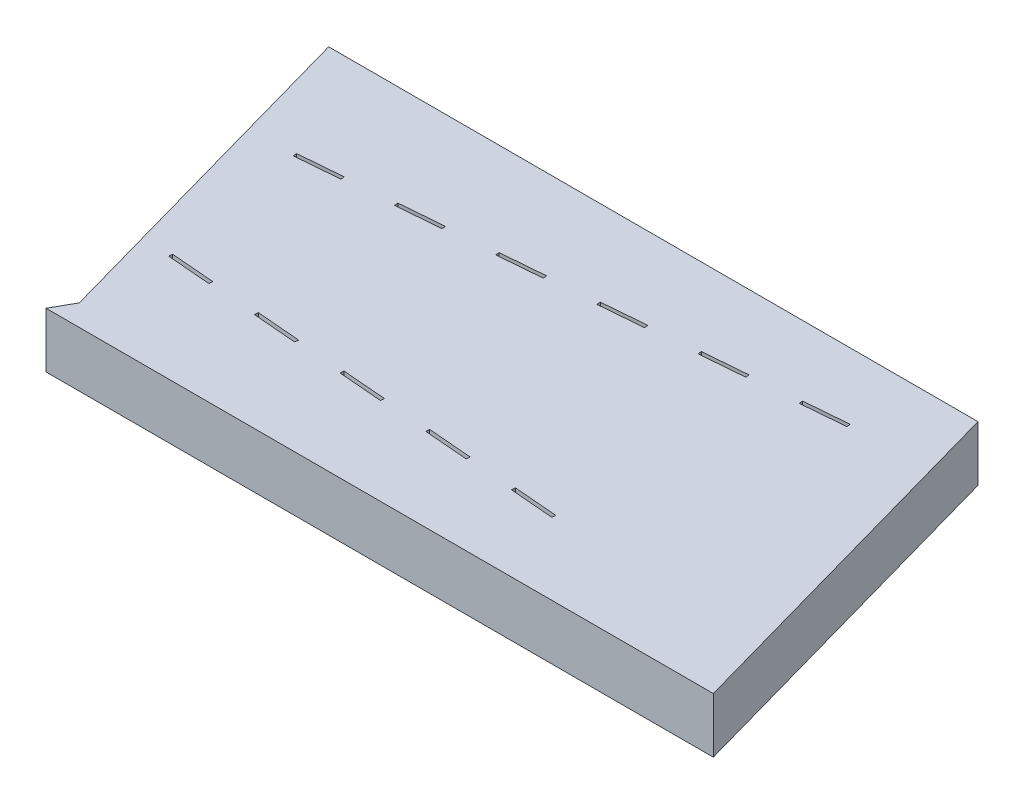
from build123d import *

# Parameters (mm, degrees)
ESQUISSE1_W                 = 33
ESQUISSE1_H                 = 10
ESQUISSE1_R                 = 1
EXTRUSION1_DEPTH            = 1.5
ENL_V_START                 = -1.5
ENL_V_MAT_EXTRU_1_OUTLINE_R = 1
ENL_V_MAT_EXTRU_1_DEPTH     = 1.5


# Read off the part's stored shape, not the designer's step: Enlèv. mat.-Extru.1
with BuildPart() as part:
    # Esquisse1 → Extrusion1 (new body)
    with BuildSketch(Plane(origin=(0, 0, 0), x_dir=(1, 0, 0), z_dir=(0, 1, 0))):
        with Locations((29.365732097, 0)):
            Rectangle(ESQUISSE1_W, ESQUISSE1_H)
        with Locations(Location((42.865732097, 0, 0), (0, 0, 270))):
            Circle(ESQUISSE1_R, mode=Mode.SUBTRACT)
        with Locations(Location((15.865732097, 0, 0), (0, 0, 270))):
            Circle(ESQUISSE1_R, mode=Mode.SUBTRACT)
        Polygon((36.878065896, 3.001382291), (36.86981937, 3.101041684), (38.065732097, 3.2), (38.073978624, 3.100340606), align=None, mode=Mode.SUBTRACT)
        Polygon((34.328504824, 2.890755264), (34.33675135, 2.79109587), (35.532664078, 2.890054186), (35.524417551, 2.989713579), align=None, mode=Mode.SUBTRACT)
        Polygon((31.787190278, 2.680468843), (31.795436804, 2.580809449), (32.991349532, 2.679767765), (32.983103005, 2.779427159), align=None, mode=Mode.SUBTRACT)
        Polygon((29.245875732, 2.470182423), (29.254122258, 2.370523029), (30.450034986, 2.469481345), (30.44178846, 2.569140738), align=None, mode=Mode.SUBTRACT)
        Polygon((26.704561186, 2.259896002), (26.712807712, 2.160236608), (27.90872044, 2.259194924), (27.900473914, 2.358854318), align=None, mode=Mode.SUBTRACT)
        Polygon((24.16324664, 2.049609582), (24.171493166, 1.949950188), (25.367405894, 2.048908503), (25.359159368, 2.148567897), align=None, mode=Mode.SUBTRACT)
        Polygon((21.621932094, 1.839323161), (21.630178621, 1.739663767), (22.826091348, 1.838622083), (22.817844822, 1.938281477), align=None, mode=Mode.SUBTRACT)
        Polygon((19.080617548, 1.629036741), (19.088864075, 1.529377347), (20.284776802, 1.628335662), (20.276530276, 1.727995056), align=None, mode=Mode.SUBTRACT)
        Polygon((22.294666135, -1.894989955), (22.302912661, -1.795330561), (23.498825389, -1.894288877), (23.490578862, -1.993948271), align=None, mode=Mode.SUBTRACT)
        Polygon((27.377295227, -2.315562796), (27.385541753, -2.215903402), (28.581454481, -2.314861718), (28.573207954, -2.414521112), align=None, mode=Mode.SUBTRACT)
        Polygon((32.459924319, -2.736135637), (32.468170845, -2.636476244), (33.664083572, -2.735434559), (33.655837046, -2.835093953), align=None, mode=Mode.SUBTRACT)
        Polygon((35.001238865, -2.946422058), (35.009485391, -2.846762664), (36.205398118, -2.94572098), (36.197151592, -3.045380374), align=None, mode=Mode.SUBTRACT)
        Polygon((29.918609773, -2.525849217), (29.926856299, -2.426189823), (31.122769027, -2.525148139), (31.1145225, -2.624807532), align=None, mode=Mode.SUBTRACT)
        Polygon((24.835980681, -2.105276376), (24.844227207, -2.005616982), (26.040139935, -2.104575297), (26.031893408, -2.204234691), align=None, mode=Mode.SUBTRACT)
        Polygon((19.753351589, -1.684703535), (19.761598115, -1.585044141), (20.957510843, -1.684002456), (20.949264317, -1.78366185), align=None, mode=Mode.SUBTRACT)
    extrude(amount=-EXTRUSION1_DEPTH)

    # Enlèv. mat.-Extru.1 outline → Enlèv. mat.-Extru.1 (cut)
    # profile 1 of 2: a face of its own
    with BuildSketch(Plane(origin=(0, 0, 0), x_dir=(1, 0, 0), z_dir=(0, 1, 0)).offset(ENL_V_START)):
        Polygon((24.723817468, -4.419702073), (22.083186059, 5), (12.865732097, 5), (12.865732097, -5), (24.397634062, -5), align=None)
        Polygon((20.949264317, -1.78366185), (19.753351589, -1.684703535), (19.761598115, -1.585044141), (20.957510843, -1.684002456), align=None, mode=Mode.SUBTRACT)
        Polygon((23.490578862, -1.993948271), (22.294666135, -1.894989955), (22.302912661, -1.795330561), (23.498825389, -1.894288877), align=None, mode=Mode.SUBTRACT)
        with Locations((15.865732097, 0)):
            Circle(ENL_V_MAT_EXTRU_1_OUTLINE_R, mode=Mode.SUBTRACT)
        Polygon((19.080617548, 1.629036741), (20.276530276, 1.727995056), (20.284776802, 1.628335662), (19.088864075, 1.529377347), align=None, mode=Mode.SUBTRACT)
        Polygon((21.621932094, 1.839323161), (22.817844822, 1.938281477), (22.826091348, 1.838622083), (21.630178621, 1.739663767), align=None, mode=Mode.SUBTRACT)
    # profile 2 of 2: a face of its own
    with BuildSketch(Plane(origin=(0, 0, 0), x_dir=(1, 0, 0), z_dir=(0, 1, 0)).offset(ENL_V_START)):
        Polygon((45.865732097, 5), (39.738529372, 5), (42.541836089, -5), (45.865732097, -5), align=None)
        with Locations((42.865732097, 0)):
            Circle(ENL_V_MAT_EXTRU_1_OUTLINE_R, mode=Mode.SUBTRACT)
    extrude(amount=ENL_V_MAT_EXTRU_1_DEPTH, mode=Mode.SUBTRACT)


solid = part.part
